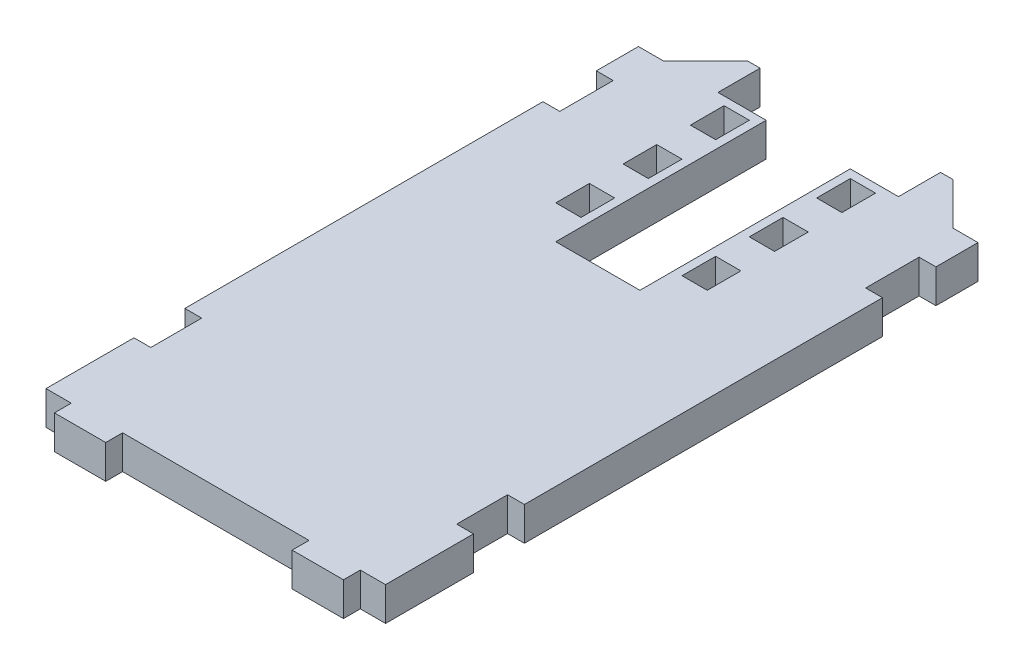
from build123d import *

# Parameters (mm, degrees)
SKETCH_1_W          = 40.35
SKETCH_1_H          = 70.4
EXTRUDE_1_DEPTH     = 4
SKETCH_2_W          = 2
SKETCH_2_H          = 6.05
SKETCH_2_H_2        = 6.35
SKETCH_2_W_2        = 10
SKETCH_2_H_3        = 25
CUT_EXTRUDE_3_DEPTH = 82.242122695
SKETCH_4_W          = 3
SKETCH_4_H          = 4
CUT_EXTRUDE_4_DEPTH = 82.242122695
SKETCH_5_W          = 6.45
SKETCH_5_H          = 4
EXTRUDE_2_DEPTH     = 5
CHAMFER_1_SIZE      = 5
SKETCH_6_W          = 6.1
SKETCH_6_H          = 4
EXTRUDE_3_DEPTH     = 2


with BuildPart() as part:
    # ｽｹｯﾁ1 → ﾎﾞｽ - 押し出し1 (new body)
    with BuildSketch(Plane(origin=(0, 0, 0), x_dir=(1, 0, 0), z_dir=(0, 1, 0))):
        with Locations((20.175, 35.2)):
            Rectangle(SKETCH_1_W, SKETCH_1_H)
    extrude(amount=EXTRUDE_1_DEPTH)

    # ｽｹｯﾁ2 → ｶｯﾄ - 押し出し3 (cut, through all)
    with BuildSketch(Plane(origin=(0, 4, 0), x_dir=(1, 0, 0), z_dir=(0, 1, 0))):
        with Locations((1, 13.475)):
            Rectangle(SKETCH_2_W, SKETCH_2_H)
        with Locations((39.35, 13.475)):
            Rectangle(SKETCH_2_W, SKETCH_2_H)
        with Locations((1, 62.225)):
            Rectangle(SKETCH_2_W, SKETCH_2_H_2)
        with Locations((39.35, 62.225)):
            Rectangle(SKETCH_2_W, SKETCH_2_H_2)
        with Locations((20.175, 57.9)):
            Rectangle(SKETCH_2_W_2, SKETCH_2_H_3)
    extrude(amount=-CUT_EXTRUDE_3_DEPTH, mode=Mode.SUBTRACT)

    # ｽｹｯﾁ4 → ｶｯﾄ - 押し出し4 (cut, through all)
    with BuildSketch(Plane(origin=(0, 4, 0), x_dir=(1, 0, 0), z_dir=(0, 1, 0))):
        with Locations((12.675, 67.4)):
            Rectangle(SKETCH_4_W, SKETCH_4_H)
        with Locations((12.675, 59.4)):
            Rectangle(SKETCH_4_W, SKETCH_4_H)
        with Locations((12.675, 51.4)):
            Rectangle(SKETCH_4_W, SKETCH_4_H)
        with Locations((27.675, 67.4)):
            Rectangle(SKETCH_4_W, SKETCH_4_H)
        with Locations((27.675, 59.4)):
            Rectangle(SKETCH_4_W, SKETCH_4_H)
        with Locations((27.675, 51.4)):
            Rectangle(SKETCH_4_W, SKETCH_4_H)
    extrude(amount=-CUT_EXTRUDE_4_DEPTH, mode=Mode.SUBTRACT)

    # ｽｹｯﾁ5 → ﾎﾞｽ - 押し出し2 (add)
    with BuildSketch(Plane(origin=(0, 0, -70.4), x_dir=(-1, 0, 0), z_dir=(0, 0, -1))):
        with Locations((-34.125, 2)):
            Rectangle(SKETCH_5_W, SKETCH_5_H)
        with Locations((-6.225, 2)):
            Rectangle(SKETCH_5_W, SKETCH_5_H)
    extrude(amount=EXTRUDE_2_DEPTH)

    # 面取り1
    chamfer_1_edges = [part.edges().sort_by_distance(p)[0] for p in [
        (3, 2, -75.4),
        (37.35, 2, -75.4),
    ]]
    chamfer(chamfer_1_edges, length=CHAMFER_1_SIZE - 0.0001)  # a hair under: the kernel refuses the full size

    # ｽｹｯﾁ6 → ﾎﾞｽ - 押し出し3 (add)
    with BuildSketch(Plane.XY):
        with Locations((6.05, 2)):
            Rectangle(SKETCH_6_W, SKETCH_6_H)
        with Locations((34.3, 2)):
            Rectangle(SKETCH_6_W, SKETCH_6_H)
    extrude(amount=EXTRUDE_3_DEPTH)


solid = part.part
